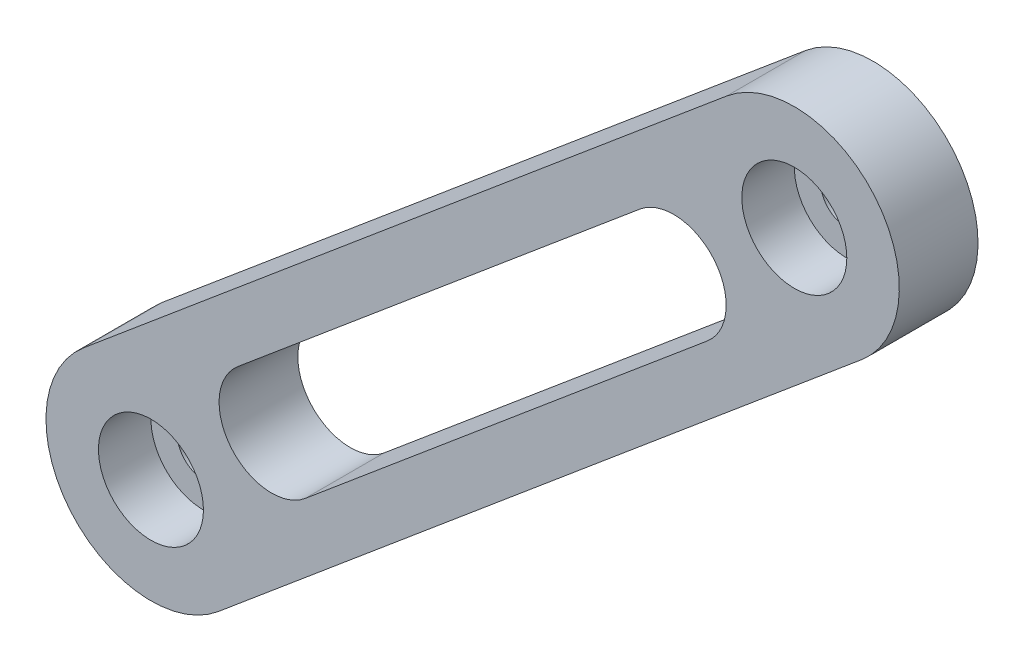
from build123d import *

# Parameters (mm, degrees)
SKETCH1_R           = 6.35
BOSS_EXTRUDE1_DEPTH = 19.05
SKETCH2_R           = 12.7
CUT_EXTRUDE1_DEPTH  = 12.7


with BuildPart() as part:
    # Sketch1 → Boss-Extrude1 (new body)
    with BuildSketch(Plane.XY):
        with BuildLine():
            Line((460.355875575, 412.642954232), (304.695644733, 282.028511943))
            ThreePointArc((304.695644733, 282.028511943), (301.564921164, 246.244177802), (337.349255305, 243.113454233))
            Line((337.349255305, 243.113454233), (493.009486147, 373.727896521))
            ThreePointArc((493.009486147, 373.727896521), (496.140209716, 409.512230662), (460.355875575, 412.642954232))
        make_face()
        with Locations((321.022450019, 262.570983088)):
            Circle(SKETCH1_R, mode=Mode.SUBTRACT)
        with Locations((476.682680861, 393.185425376)):
            Circle(SKETCH1_R, mode=Mode.SUBTRACT)
        with BuildLine():
            Line((455.659790221, 358.96645302), (358.372145945, 277.33242659))
            ThreePointArc((358.372145945, 277.33242659), (340.479978874, 278.897788374), (342.045340659, 296.789955445))
            Line((342.045340659, 296.789955445), (439.332984935, 378.423981875))
            ThreePointArc((439.332984935, 378.423981875), (457.225152006, 376.85862009), (455.659790221, 358.96645302))
        make_face(mode=Mode.SUBTRACT)
    extrude(amount=BOSS_EXTRUDE1_DEPTH)

    # Sketch2 → Cut-Extrude1 (cut)
    with BuildSketch(Plane.XY.offset(19.05)):
        with Locations((321.022450019, 262.570983088)):
            Circle(SKETCH2_R)
        with Locations((476.682680861, 393.185425376)):
            Circle(SKETCH2_R)
    extrude(amount=-CUT_EXTRUDE1_DEPTH, mode=Mode.SUBTRACT)


solid = part.part
